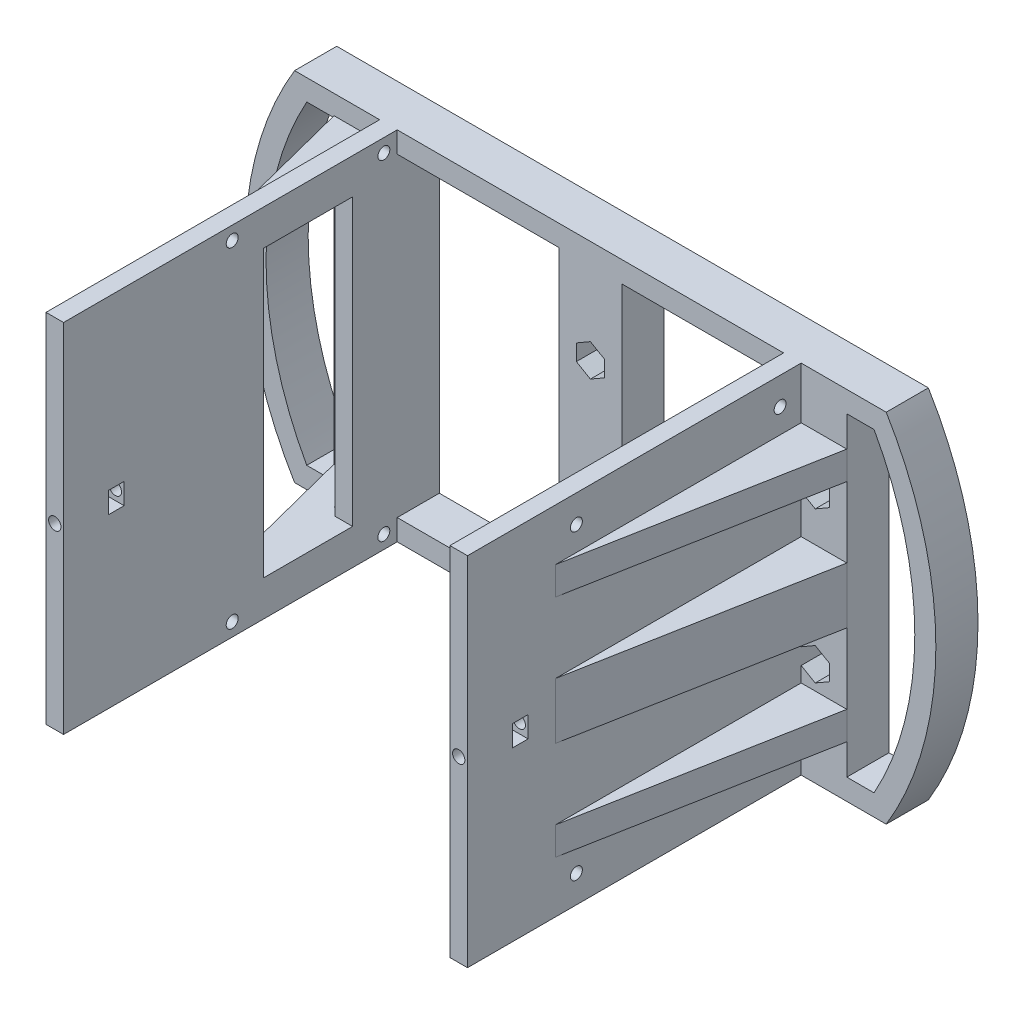
from build123d import *

# Parameters (mm, degrees)
SKETCH1_W                = 152.4
SKETCH1_H                = 101.6
BOSS_EXTRUDE1_DEPTH      = 12
F_6_CLEARANCE_HOLE1_D    = 3.7973
BOSS_EXTRUDE2_DEPTH      = 12
CUT_EXTRUDE2_DEPTH       = 9.525
SKETCH5_W                = 46.008
SKETCH5_H                = 89.6
CUT_EXTRUDE1_DEPTH       = 112.353602017
SKETCH7_W                = 5
SKETCH7_H                = 101.6
BOSS_EXTRUDE3_DEPTH      = 50.8
M3_CLEARANCE_HOLE1_D     = 3.4
SKETCH9_W                = 25.4
SKETCH9_H                = 81.28
CUT_EXTRUDE3_DEPTH       = 174.339792114
BOSS_EXTRUDE4_START      = -45.29
BOSS_EXTRUDE4_DEPTH      = 4.65
BOSS_EXTRUDE4_START_2    = 40.64
BOSS_EXTRUDE4_2_DEPTH    = 4.65
CUT_EXTRUDE4_DEPTH       = 152.169152879
SKETCH12_W               = 5
SKETCH12_H               = 101.6
BOSS_EXTRUDE5_DEPTH      = 70
M3_CLEARANCE_HOLE2_D     = 3.4
M3_CLEARANCE_HOLE2_DEPTH = 43.3535
BOSS_EXTRUDE6_REACH      = 193.164
SKETCH14_W               = 71.196910045
SKETCH14_H               = 16
SKETCH14_H_2             = 8
BOSS_EXTRUDE7_DEPTH      = 25
BOSS_EXTRUDE8_REACH      = 155.963
SKETCH16_W               = 5
SKETCH16_H               = 101.6
SKETCH17_R               = 1.75
CUT_EXTRUDE5_DEPTH       = 20
CUT_EXTRUDE6_DEPTH       = 198.763845357
CUT_EXTRUDE6_DEPTH_BACK  = 198.763845357
SKETCH19_W               = 4.5
SKETCH19_H               = 6


# Read off the part's stored shape, not the designer's step: Boss-Extrude4
with BuildPart() as part:
    # Sketch1 → Boss-Extrude1 (new body)
    with BuildSketch(Plane.XY):
        Rectangle(SKETCH1_W, SKETCH1_H)
    extrude(amount=BOSS_EXTRUDE1_DEPTH)

    # #6 Clearance Hole1 (through all)
    with Locations(Plane(origin=(-64.008, 21.46427, 12), x_dir=(1, 0, 0), z_dir=(0, 0, 1))):
        with Locations((0, 0), (128.016, 0), (128.016, -42.92854), (0, -42.92854), (64.008, 0), (64.008, -42.92854)):
            Hole(F_6_CLEARANCE_HOLE1_D / 2)

    # Sketch4 → Boss-Extrude2 (add)
    with BuildSketch(Plane.XY.offset(12)):
        with BuildLine():
            Line((-76.2, 50.8), (-84.22793291, 50.8))
            ThreePointArc((-84.22793291, 50.8), (-98.3615, 0), (-84.22793291, -50.8))
            Line((-84.22793291, -50.8), (-76.2, -50.8))
            Line((-76.2, -50.8), (-76.2, 50.8))
        make_face()
        with BuildLine():
            Line((76.2, -50.8), (84.22793291, -50.8))
            ThreePointArc((84.22793291, -50.8), (98.3615, 0), (84.22793291, 50.8))
            Line((84.22793291, 50.8), (76.2, 50.8))
            Line((76.2, 50.8), (76.2, -50.8))
        make_face()
    extrude(amount=-BOSS_EXTRUDE2_DEPTH)

    # Sketch6 → Cut-Extrude2 (cut)
    with BuildSketch(Plane.XY.offset(12)):
        Polygon((-68.008, 19.154868923), (-64.008, 16.845467846), (-60.008, 19.154868923), (-60.008, 23.773671077), (-64.008, 26.083072154), (-68.008, 23.773671077), align=None)
        Polygon((4, 19.154868923), (4, 23.773671077), (0, 26.083072154), (-4, 23.773671077), (-4, 19.154868923), (0, 16.845467846), align=None)
        Polygon((68.008, 19.154868923), (68.008, 23.773671077), (64.008, 26.083072154), (60.008, 23.773671077), (60.008, 19.154868923), (64.008, 16.845467846), align=None)
        Polygon((68.008, -23.773671077), (68.008, -19.154868923), (64.008, -16.845467846), (60.008, -19.154868923), (60.008, -23.773671077), (64.008, -26.083072154), align=None)
        Polygon((4, -23.773671077), (4, -19.154868923), (0, -16.845467846), (-4, -19.154868923), (-4, -23.773671077), (0, -26.083072154), align=None)
        Polygon((-60.008, -23.773671077), (-60.008, -19.154868923), (-64.008, -16.845467846), (-68.008, -19.154868923), (-68.008, -23.773671077), (-64.008, -26.083072154), align=None)
    extrude(amount=-CUT_EXTRUDE2_DEPTH, mode=Mode.SUBTRACT)

    # Sketch5 → Cut-Extrude1 (cut, through all)
    with BuildSketch(Plane.XY.offset(12)):
        with BuildLine():
            Line((-73.008, 44.8), (-73.008, -44.8))
            Line((-73.008, -44.8), (-80.768847226, -44.8))
            ThreePointArc((-80.768847226, -44.8), (-92.3615, 0), (-80.768847226, 44.8))
            Line((-80.768847226, 44.8), (-73.008, 44.8))
        make_face()
        with BuildLine():
            Line((73.008, 44.8), (73.008, -44.8))
            Line((73.008, -44.8), (80.768847226, -44.8))
            ThreePointArc((80.768847226, -44.8), (92.3615, 0), (80.768847226, 44.8))
            Line((80.768847226, 44.8), (73.008, 44.8))
        make_face()
        with Locations((-32.004, 0)):
            Rectangle(SKETCH5_W, SKETCH5_H)
        with Locations((32.004, 0)):
            Rectangle(SKETCH5_W, SKETCH5_H)
    extrude(amount=-CUT_EXTRUDE1_DEPTH, mode=Mode.SUBTRACT)

    # Sketch7 → Boss-Extrude3 (add)
    with BuildSketch(Plane.XY.offset(12)):
        with Locations((-57.508, 0)):
            Rectangle(SKETCH7_W, SKETCH7_H)
    extrude(amount=BOSS_EXTRUDE3_DEPTH)

    # M3 Clearance Hole1 (through all)
    with Locations(Plane(origin=(-55.008, 46.99, 58.99), x_dir=(0, 1, 0), z_dir=(1, 0, 0))):
        with Locations((0, 0), (0, -43.18), (-93.98, -43.18), (-93.98, 0)):
            Hole(M3_CLEARANCE_HOLE1_D / 2)

    # Sketch9 → Cut-Extrude3 (cut, through all)
    with BuildSketch(Plane(origin=(-55.008, 0, 0), x_dir=(0, 0, -1), z_dir=(1, 0, 0))):
        with Locations((-37.4, 0)):
            Rectangle(SKETCH9_W, SKETCH9_H)
    extrude(amount=-CUT_EXTRUDE3_DEPTH, mode=Mode.SUBTRACT)

    # Boss-Extrude4 outline → Boss-Extrude4 (add)
    with BuildSketch(Plane(origin=(0, 0, 0), x_dir=(1, 0, 0), z_dir=(0, 1, 0)).offset(BOSS_EXTRUDE4_START)):
        Polygon((-60.008, -12), (-73.008, -12), (-60.008, -62.8), align=None)
    extrude(amount=BOSS_EXTRUDE4_DEPTH)

    # Boss-Extrude4 2 outline → Boss-Extrude4 2 (add)
    with BuildSketch(Plane(origin=(0, 0, 0), x_dir=(1, 0, 0), z_dir=(0, 1, 0)).offset(BOSS_EXTRUDE4_START_2)):
        Polygon((-60.008, -12), (-73.008, -12), (-60.008, -62.8), align=None)
    extrude(amount=BOSS_EXTRUDE4_2_DEPTH)

    # Sketch11 → Cut-Extrude4 (cut, through all)
    with BuildSketch(Plane(origin=(0, -45.29, 0), x_dir=(-1, 0, 0), z_dir=(0, -1, 0))):
        Polygon((64.508, -18.81), (62.258, -22.707114317), (60.008, -18.81), (60.008, -12.81), (64.508, -12.81), align=None)
        Polygon((60.008, -55.99), (64.508, -55.99), (64.508, -61.99), (64.508, -62.8), (60.008, -62.8), (60.008, -61.99), align=None)
    extrude(amount=-CUT_EXTRUDE4_DEPTH, mode=Mode.SUBTRACT)

    # Sketch12 → Boss-Extrude5 (add)
    with BuildSketch(Plane.XY.offset(12)):
        with Locations((57.508, 0)):
            Rectangle(SKETCH12_W, SKETCH12_H)
    extrude(amount=BOSS_EXTRUDE5_DEPTH)

    # M3 Clearance Hole2
    with Locations(Plane(origin=(55.008, -43, 76), x_dir=(0, -1, 0), z_dir=(-1, 0, 0))):
        with Locations((0, 0), (0, -58), (-86, -58), (-86, 0)):
            Hole(M3_CLEARANCE_HOLE2_D / 2, depth=M3_CLEARANCE_HOLE2_DEPTH)

    # Boss-Extrude6: up to this face of the body (flat: up to its plane)
    boss_extrude6_end = Plane(part.part.faces().sort_by_distance((60.008, 0, 46.511614943))[0])
    # Sketch14 → Boss-Extrude6 (add, up to the picked face)
    with BuildSketch(Plane(origin=(72.728190965, 0, 13.506664036), x_dir=(-0.18259219384277645, 0, 0.983188736076488), z_dir=(-0.9831887360764879, 0, -0.18259219384277642)), mode=Mode.PRIVATE) as boss_extrude6_sk1:
        with Locations((34.066028968, 0)):
            Rectangle(SKETCH14_W, SKETCH14_H)
    boss_extrude6_tool1 = split(extrude(boss_extrude6_sk1.sketch, amount=BOSS_EXTRUDE6_REACH, mode=Mode.PRIVATE), bisect_by=boss_extrude6_end, keep=Keep.BOTH, mode=Mode.PRIVATE)
    # Sketch14 → Boss-Extrude6 (add, up to the picked face)
    with BuildSketch(Plane(origin=(72.728190965, 0, 13.506664036), x_dir=(-0.18259219384277645, 0, 0.983188736076488), z_dir=(-0.9831887360764879, 0, -0.18259219384277642)), mode=Mode.PRIVATE) as boss_extrude6_sk2:
        with Locations((34.066028968, -32.083072154)):
            Rectangle(SKETCH14_W, SKETCH14_H_2)
    boss_extrude6_tool2 = split(extrude(boss_extrude6_sk2.sketch, amount=BOSS_EXTRUDE6_REACH, mode=Mode.PRIVATE), bisect_by=boss_extrude6_end, keep=Keep.BOTH, mode=Mode.PRIVATE)
    # Sketch14 → Boss-Extrude6 (add, up to the picked face)
    with BuildSketch(Plane(origin=(72.728190965, 0, 13.506664036), x_dir=(-0.18259219384277645, 0, 0.983188736076488), z_dir=(-0.9831887360764879, 0, -0.18259219384277642)), mode=Mode.PRIVATE) as boss_extrude6_sk3:
        with Locations((34.066028968, 32.083072154)):
            Rectangle(SKETCH14_W, SKETCH14_H_2)
    boss_extrude6_tool3 = split(extrude(boss_extrude6_sk3.sketch, amount=BOSS_EXTRUDE6_REACH, mode=Mode.PRIVATE), bisect_by=boss_extrude6_end, keep=Keep.BOTH, mode=Mode.PRIVATE)
    add(boss_extrude6_tool1.solids().sort_by(Axis((66.508, 0, 47), (-0.9831887360764879, 0, -0.18259219384277642)))[0])
    add(boss_extrude6_tool2.solids().sort_by(Axis((66.508, -32.083072, 47), (-0.9831887360764879, 0, -0.18259219384277642)))[0])
    add(boss_extrude6_tool3.solids().sort_by(Axis((66.508, 32.083072, 47), (-0.9831887360764879, 0, -0.18259219384277642)))[0])

    # Sketch15 → Boss-Extrude7 (add)
    with BuildSketch(Plane.XY.offset(82)):
        Polygon((60.008, 50.8), (55.008, 50.8), (55.008, -50.8), (60.008, -50.8), (60.008, -36.083072154), (60.008, -28.083072154), (60.008, -8), (60.008, 8), (60.008, 28.083072154), (60.008, 36.083072154), align=None)
    extrude(amount=BOSS_EXTRUDE7_DEPTH)

    # Sketch16 → Boss-Extrude8 (add, up to next)
    with BuildSketch(Plane.XY.offset(107), mode=Mode.PRIVATE) as boss_extrude8_sk1:
        with Locations((-57.508, 0)):
            Rectangle(SKETCH16_W, SKETCH16_H)
    boss_extrude8_tool1 = extrude(boss_extrude8_sk1.sketch, amount=-BOSS_EXTRUDE8_REACH, mode=Mode.PRIVATE) - part.part
    add(boss_extrude8_tool1.solids().sort_by_distance((-57.508, 0, 107))[0])

    # Sketch17 → Cut-Extrude5 (cut)
    with BuildSketch(Plane.XY.offset(107)):
        with Locations((-57.508, 0)):
            Circle(SKETCH17_R)
        with Locations((57.508, 0)):
            Circle(SKETCH17_R)
    extrude(amount=-CUT_EXTRUDE5_DEPTH, mode=Mode.SUBTRACT)

    # Sketch19 → Cut-Extrude6 (cut, two sides: drawn at the far end of the back side and taken through both)
    with BuildSketch(Plane.ZY.offset(60.008).offset(-CUT_EXTRUDE6_DEPTH_BACK)):
        with Locations((92, 0)):
            Rectangle(SKETCH19_W, SKETCH19_H)
    extrude(amount=CUT_EXTRUDE6_DEPTH + CUT_EXTRUDE6_DEPTH_BACK, mode=Mode.SUBTRACT)


solid = part.part
